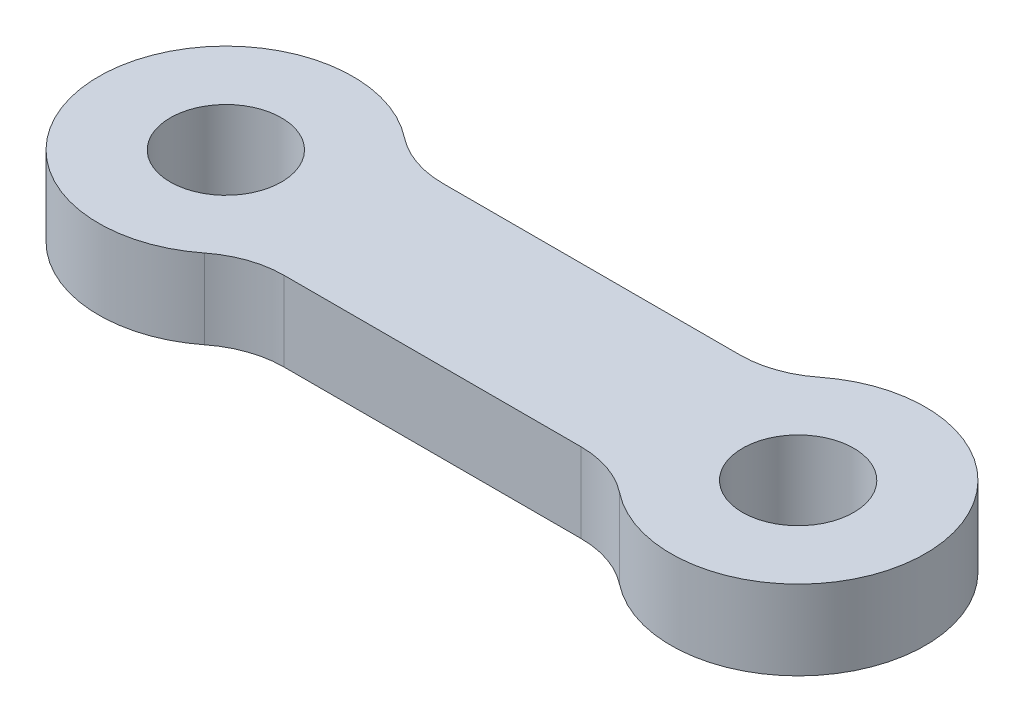
from build123d import *

# Parameters (mm, degrees)
SKETCH1_R           = 1.75
BOSS_EXTRUDE1_DEPTH = 2.5
FILLET1_R           = 3


with BuildPart() as part:
    # Sketch1 → Boss-Extrude1 (new body)
    with BuildSketch(Plane(origin=(0, 0, 0), x_dir=(1, 0, 0), z_dir=(0, 1, 0))):
        with BuildLine():
            ThreePointArc((3.122498999, 2.5), (-4, 0), (3.122498999, -2.5))
            Line((3.122498999, -2.5), (14.877501001, -2.5))
            ThreePointArc((14.877501001, -2.5), (22, 0), (14.877501001, 2.5))
            Line((14.877501001, 2.5), (3.122498999, 2.5))
        make_face()
        Circle(SKETCH1_R, mode=Mode.SUBTRACT)
        with Locations((18, 0)):
            Circle(SKETCH1_R, mode=Mode.SUBTRACT)
    extrude(amount=BOSS_EXTRUDE1_DEPTH)

    # Fillet1
    fillet1_edges = [part.edges().sort_by_distance(p)[0] for p in [
        (3.122498999, 1.25, 2.5),
        (14.877501001, 1.25, 2.5),
        (14.877501001, 1.25, -2.5),
        (3.122498999, 1.25, -2.5),
    ]]
    fillet(fillet1_edges, radius=FILLET1_R)


solid = part.part
